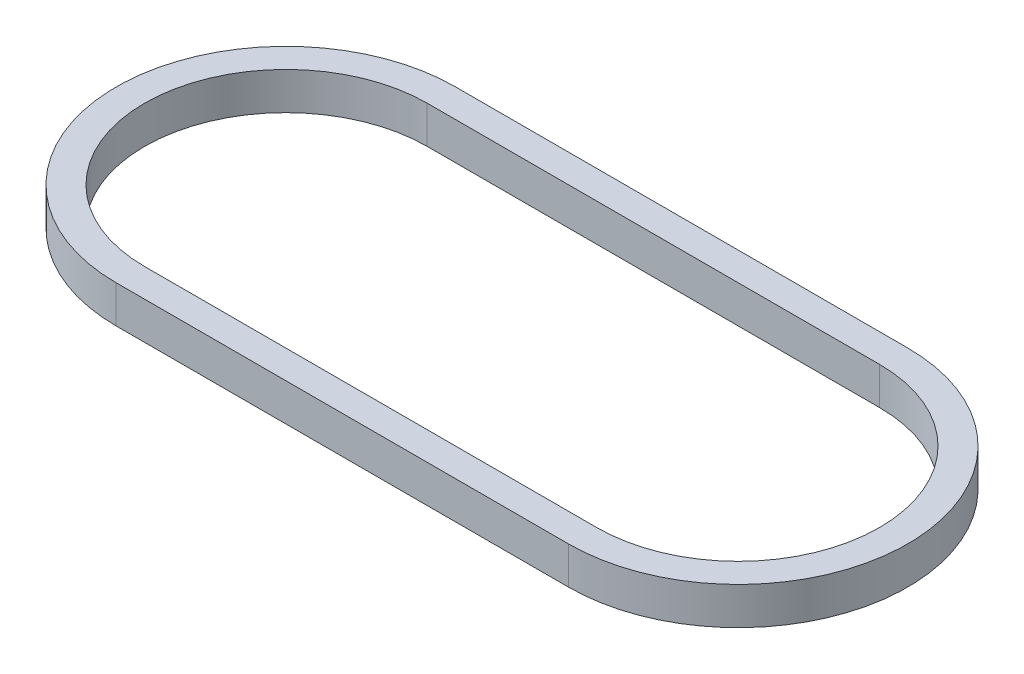
from build123d import *

# Parameters (mm, degrees)
BOSS_EXTRUDE1_DEPTH = 7.7978


with BuildPart() as part:
    # Sketch1 → Boss-Extrude1 (new body)
    with BuildSketch(Plane(origin=(0, 0, 0), x_dir=(1, 0, 0), z_dir=(0, 1, 0))):
        with BuildLine():
            Line((-47.1, 35.3387), (47.1, 35.3387))
            ThreePointArc((47.1, 35.3387), (82.4387, 0), (47.1, -35.3387))
            Line((47.1, -35.3387), (-47.1, -35.3387))
            ThreePointArc((-47.1, -35.3387), (-82.4387, 0), (-47.1, 35.3387))
        make_face()
        with BuildLine():
            Line((-47.1, 29.4459), (47.1, 29.4459))
            ThreePointArc((47.1, 29.4459), (76.5459, 0), (47.1, -29.4459))
            Line((47.1, -29.4459), (-47.1, -29.4459))
            ThreePointArc((-47.1, -29.4459), (-76.5459, 0), (-47.1, 29.4459))
        make_face(mode=Mode.SUBTRACT)
    extrude(amount=BOSS_EXTRUDE1_DEPTH)


solid = part.part
